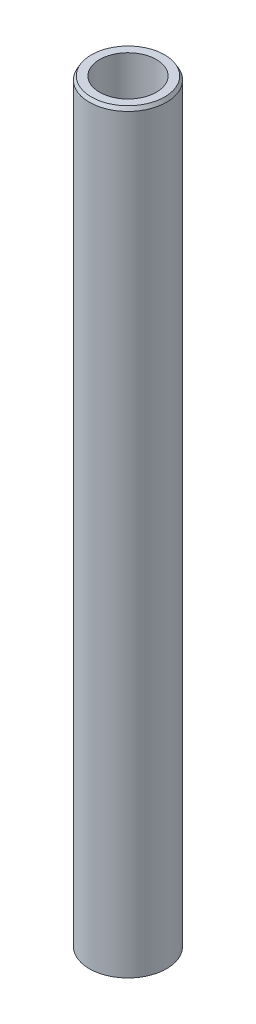
from build123d import *
from OCP.BRepFilletAPI import BRepFilletAPI_MakeChamfer

# Parameters (mm, degrees)
SKETCH1_R           = 25
BOSS_EXTRUDE1_DEPTH = 489.247888928
SKETCH2_R           = 18.374683723
CUT_EXTRUDE1_DEPTH  = 491.523696492
CHAMFER1_SIZE       = 2.275946652
CHAMFER1_SIZE2      = 1.314018412


with BuildPart() as part:
    # Sketch1 → Boss-Extrude1 (new body)
    with BuildSketch(Plane(origin=(0, 0, 0), x_dir=(1, 0, 0), z_dir=(0, 1, 0))):
        Circle(SKETCH1_R)
    extrude(amount=BOSS_EXTRUDE1_DEPTH)

    # Sketch2 → Cut-Extrude1 (cut, through all)
    with BuildSketch(Plane(origin=(0, 0, 0), x_dir=(1, 0, 0), z_dir=(0, 1, 0))):
        Circle(SKETCH2_R)
    extrude(amount=CUT_EXTRUDE1_DEPTH, mode=Mode.SUBTRACT)

    # Chamfer1: one chamfer whose edges measure the first distance from different faces: ONE call of the kernel's chamfer builder (chamfer() names one face for all edges)
    chamfer1_edges_1 = [part.edges().sort_by_distance(p)[0] for p in [
        (-25, 489.247888928, 0),
    ]]
    chamfer1_side_1 = [part.faces().sort_by_distance(p)[0] for p in [
        (-25, 244.623944464, 0),
    ]]
    chamfer1_edges_2 = [part.edges().sort_by_distance(p)[0] for p in [
        (-25, 0, 0),
    ]]
    chamfer1_side_2 = [part.faces().sort_by_distance(p)[0] for p in [
        (-24.292893219, 0, 0),
    ]]
    chamfer1 = BRepFilletAPI_MakeChamfer(part.part.solid().wrapped)
    for e in chamfer1_edges_1:
        chamfer1.Add(CHAMFER1_SIZE, CHAMFER1_SIZE2, e.wrapped, chamfer1_side_1[0].wrapped)  # the first distance lies on this face
    for e in chamfer1_edges_2:
        chamfer1.Add(CHAMFER1_SIZE, CHAMFER1_SIZE2, e.wrapped, chamfer1_side_2[0].wrapped)  # the first distance lies on this face
    add(Compound.cast(chamfer1.Shape()), mode=Mode.REPLACE)


solid = part.part
